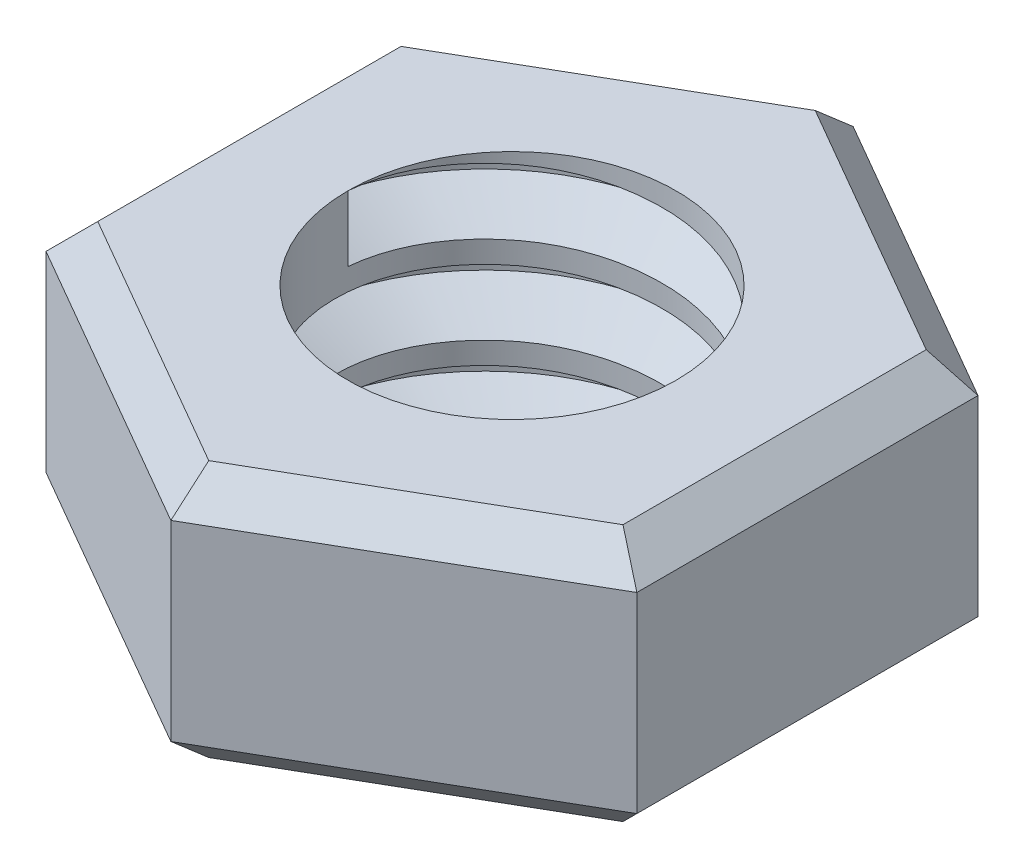
from build123d import *

# Parameters (mm, degrees)
SKETCH_1_R      = 1.5
EXTRUDE_1_DEPTH = 2.35
CHAMFER_1_SIZE  = 0.3
THREAD_1_PITCH  = 0.8


with BuildPart() as part:
    # Sketch 1 → 凸台-拉伸1 (new body)
    with BuildSketch(Plane(origin=(0, 0, 0), x_dir=(1, 0, 0), z_dir=(0, 1, 0))):
        Polygon((0, 3.117691454), (-2.7, 1.558845727), (-2.7, -1.558845727), (0, -3.117691454), (2.7, -1.558845727), (2.7, 1.558845727), align=None)
        with Locations(Location((0, 0, 0), (0, 0, 270))):
            Circle(SKETCH_1_R, mode=Mode.SUBTRACT)
    extrude(amount=EXTRUDE_1_DEPTH)

    # 倒角1
    chamfer_1_edges = [part.edges().sort_by_distance(p)[0] for p in [
        (-2.7, 2.35, 0),
        (-1.35, 2.35, 2.33826859),
        (1.35, 2.35, 2.33826859),
        (2.7, 2.35, 0),
        (1.35, 2.35, -2.33826859),
        (2.7, 0, 0),
        (1.35, 0, 2.33826859),
        (-1.35, 0, 2.33826859),
        (-1.35, 2.35, -2.33826859),
        (-2.7, 0, 0),
        (-1.35, 0, -2.33826859),
        (1.35, 0, -2.33826859),
    ]]
    chamfer(chamfer_1_edges, length=CHAMFER_1_SIZE)

    # 螺纹线1: the profile of Sketch 1 2 profile screwed along a right-hand helix of 2.9375 turns, 8 arcs to a turn; built about Z, then put on its axis
    thread_1_z = Axis((0, 0, 0), (0, 0, 1))
    thread_1_corners = [(1.4997, 0, -0.000173205), (1.9330127, 0, 0.249999999), (1.9330127, 0, 0.349999999), (1.4997, 0, 0.600173203)]
    with BuildLine(mode=Mode.PRIVATE) as thread_1_profile:
        Line(thread_1_corners[0], thread_1_corners[1])
        Line(thread_1_corners[1], thread_1_corners[2])
        Line(thread_1_corners[2], thread_1_corners[3])
        Line(thread_1_corners[3], thread_1_corners[0])
    thread_1_cap = Face(thread_1_profile.wire())
    thread_1_turn_angles = [0, 22.5, 45, 67.5, 90, 112.5, 135, 157.5, 180, 202.5, 225, 247.5, 270, 292.5, 315, 337.5, 360]
    thread_1_turn_weights = [1, 0.9238795325112867, 1, 0.9238795325112867, 1, 0.9238795325112867, 1, 0.9238795325112867, 1, 0.9238795325112867, 1, 0.9238795325112867, 1, 0.9238795325112867, 1, 0.9238795325112867, 1]
    thread_1_turn_rails = [Edge.make_bspline([Vector(p[0], p[1], 0).rotate(thread_1_z, thread_1_turn_angles[k]) / thread_1_turn_weights[k] + Vector(0, 0, p[2] + THREAD_1_PITCH * thread_1_turn_angles[k] / 360) for k in range(17)], [0, 0, 0, 1, 1, 2, 2, 3, 3, 4, 4, 5, 5, 6, 6, 7, 7, 8, 8, 8], 2, thread_1_turn_weights) for p in thread_1_corners]
    thread_1_turn_sides = [Face.make_surface_from_curves(thread_1_turn_rails[p[0]], thread_1_turn_rails[p[1]]) for p in [(0, 1), (1, 2), (2, 3), (3, 0)]]
    thread_1_last_angles = [720, 742.5, 765, 787.5, 810, 832.5, 855, 877.5, 900, 922.5, 945, 967.5, 990, 1012.5, 1035, 1046.25, 1057.5]
    thread_1_last_weights = [1, 0.9238795325112867, 1, 0.9238795325112867, 1, 0.9238795325112867, 1, 0.9238795325112867, 1, 0.9238795325112867, 1, 0.9238795325112867, 1, 0.9238795325112867, 1, 0.9807852804032304, 1]
    thread_1_last_rails = [Edge.make_bspline([Vector(p[0], p[1], 0).rotate(thread_1_z, thread_1_last_angles[k]) / thread_1_last_weights[k] + Vector(0, 0, p[2] + THREAD_1_PITCH * thread_1_last_angles[k] / 360) for k in range(17)], [0, 0, 0, 1, 1, 2, 2, 3, 3, 4, 4, 5, 5, 6, 6, 7, 7, 8, 8, 8], 2, thread_1_last_weights) for p in thread_1_corners]
    thread_1_last_sides = [Face.make_surface_from_curves(thread_1_last_rails[p[0]], thread_1_last_rails[p[1]]) for p in [(0, 1), (1, 2), (2, 3), (3, 0)]]
    thread_1 = Plane(origin=(0, 2.35, 0), x_dir=(-1, 0, 0), z_dir=(0, -1, 0)) * Solid(Shell([*[p.moved(Location((0, 0, THREAD_1_PITCH * i))) for i in range(2) for p in thread_1_turn_sides], *thread_1_last_sides, thread_1_cap, thread_1_cap.rotate(thread_1_z, 1057.5).moved(Location((0, 0, THREAD_1_PITCH * 1057.5 / 360)))]))
    add(thread_1, mode=Mode.SUBTRACT)


solid = part.part
